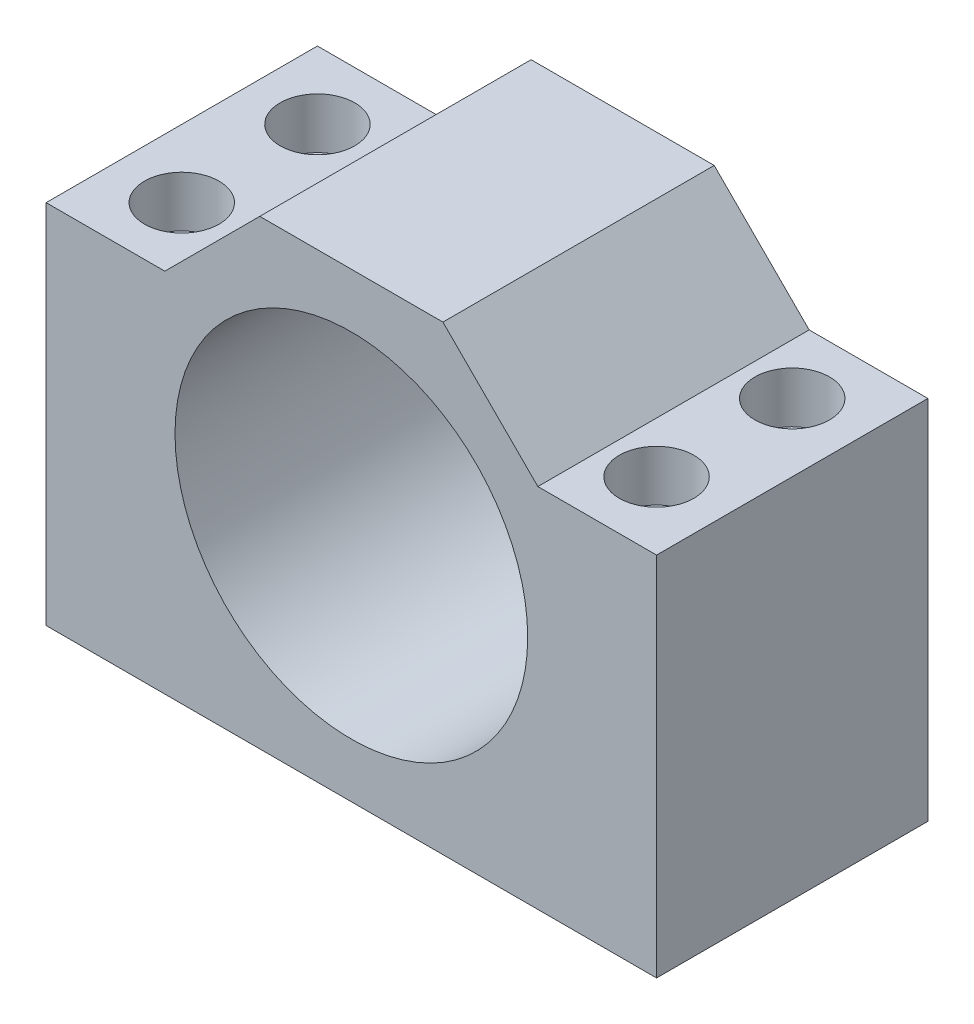
from build123d import *

# Parameters (mm, degrees)
SKETCH1_R         = 26
EXTRUSION1_DEPTH  = 40
HOLE1_D           = 6.6
HOLE1_CBORE_D     = 11
HOLE1_CBORE_DEPTH = 7.499997


with BuildPart() as part:
    # Sketch1 → Extrusion1 (new body)
    with BuildSketch(Plane.XY):
        Polygon((3.865726522, 9.909240265), (3.865726522, -44.090759735), (93.865726522, -44.090759735), (93.865726522, 9.909240265), (76.365726522, 9.909240265), (62.365726522, 23.909240265), (35.365726522, 23.909240265), (21.365726522, 9.909240265), align=None)
        with Locations((48.865726522, -10.090759735)):
            Circle(SKETCH1_R, mode=Mode.SUBTRACT)
    extrude(amount=EXTRUSION1_DEPTH)

    # Hole1 (through all)
    with Locations(Plane(origin=(0, 9.909240265, 0), x_dir=(1, 0, 0), z_dir=(0, 1, 0))):
        with Locations((13.865726522, -10), (13.865726522, -30), (83.865726522, -10), (83.865726522, -30)):
            CounterBoreHole(HOLE1_D / 2, HOLE1_CBORE_D / 2, HOLE1_CBORE_DEPTH)


solid = part.part
